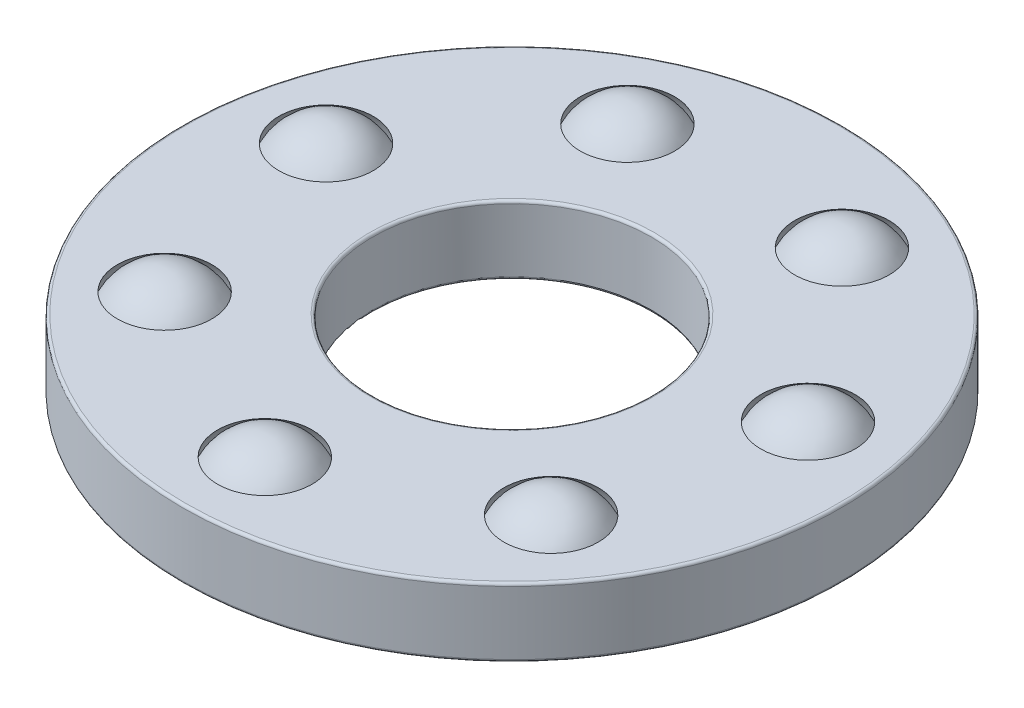
from build123d import *

# Parameters (mm, degrees)
SKETCH1_W         = 3.462
SKETCH1_H         = 1.25
CIRPATTERN1_COUNT = 7
CIRPATTERN1_ANGLE = 308.571428571
CIRPATTERN2_COUNT = 7
SKETCH4_W         = 3.462
SKETCH4_H         = 1.46
FILLET1_R         = 0.0492
FILLET2_R         = 0.0492
FILLET3_R         = 0.0492


with BuildPart() as part:
    # Sketch1 → Revolve1 (revolve)
    with BuildSketch(Plane(origin=(0, 0, 0), x_dir=(0, 0, -1), z_dir=(1, 0, 0))):
        with Locations((-4.269, 0)):
            Rectangle(SKETCH1_W, SKETCH1_H)
    revolve(axis=Axis((0, -2.46, 0), (0, 1, 0)))

    # Sketch3 → Cut-Revolve1 (revolve, cut)
    with BuildSketch(Plane(origin=(0, 0, 0), x_dir=(0, 0, -1), z_dir=(1, 0, 0))):
        with BuildLine():
            Line((-4.5, 1.0625), (-4.5, -1.0625))
            ThreePointArc((-4.5, -1.0625), (-5.5625, 0), (-4.5, 1.0625))
        make_face()
    cut_revolve1 = revolve(axis=Axis((0, 1.0625, 4.5), (0, -1, 0)), mode=Mode.SUBTRACT)

    # CirPattern2: Cut-Revolve1 ×7 about axis
    cirpattern2_axis = Axis((0, 2.46, 0), (0, -1, 0))
    for i in range(1, CIRPATTERN2_COUNT):
        add(cut_revolve1.rotate(cirpattern2_axis, i * 360 / CIRPATTERN2_COUNT), mode=Mode.SUBTRACT)

    # Fillet2
    fillet2_edges = [part.edges().sort_by_distance(p)[0] for p in [
        (0, -0.625, -2.538),
        (0, 0.625, -2.538),
        (0, -0.625, -6),
        (0, 0.625, -6),
    ]]
    fillet(fillet2_edges, radius=FILLET2_R)


with BuildPart() as body_2:
    # Sketch2 → Revolve2 (revolve)
    with BuildSketch(Plane(origin=(0, 0, 0), x_dir=(0, 0, -1), z_dir=(1, 0, 0))):
        with BuildLine():
            Line((-4.5, 1), (-4.5, -1))
            ThreePointArc((-4.5, -1), (-5.5, 0), (-4.5, 1))
        make_face()
    revolve(axis=Axis((0, 1, 4.5), (0, -1, 0)))


with BuildPart() as cirpattern1_1:
    # CirPattern1: pattern copy
    add(body_2.part.rotate(Axis((0, 2.46, 0), (0, -1, 0)), 1 * CIRPATTERN1_ANGLE / (CIRPATTERN1_COUNT - 1)))


with BuildPart() as cirpattern1_2:
    # CirPattern1: pattern copy
    add(body_2.part.rotate(Axis((0, 2.46, 0), (0, -1, 0)), 2 * CIRPATTERN1_ANGLE / (CIRPATTERN1_COUNT - 1)))


with BuildPart() as cirpattern1_3:
    # CirPattern1: pattern copy
    add(body_2.part.rotate(Axis((0, 2.46, 0), (0, -1, 0)), 3 * CIRPATTERN1_ANGLE / (CIRPATTERN1_COUNT - 1)))


with BuildPart() as cirpattern1_4:
    # CirPattern1: pattern copy
    add(body_2.part.rotate(Axis((0, 2.46, 0), (0, -1, 0)), 4 * CIRPATTERN1_ANGLE / (CIRPATTERN1_COUNT - 1)))


with BuildPart() as cirpattern1_5:
    # CirPattern1: pattern copy
    add(body_2.part.rotate(Axis((0, 2.46, 0), (0, -1, 0)), 5 * CIRPATTERN1_ANGLE / (CIRPATTERN1_COUNT - 1)))


with BuildPart() as cirpattern1_6:
    # CirPattern1: pattern copy
    add(body_2.part.rotate(Axis((0, 2.46, 0), (0, -1, 0)), 6 * CIRPATTERN1_ANGLE / (CIRPATTERN1_COUNT - 1)))


with BuildPart() as body_9:
    # Sketch4 → Revolve3 (revolve)
    with BuildSketch(Plane(origin=(0, 0, 0), x_dir=(0, 0, -1), z_dir=(1, 0, 0))):
        with Locations((-4.269, 1.73)):
            Rectangle(SKETCH4_W, SKETCH4_H)
        with Locations((-4.269, -1.73)):
            Rectangle(SKETCH4_W, SKETCH4_H)
    revolve(axis=Axis((0, -2.46, 0), (0, 1, 0)))

    # Fillet1
    fillet1_edges = [body_9.edges().sort_by_distance(p)[0] for p in [
        (0, 1, -2.538),
        (0, 2.46, -2.538),
        (0, 1, -6),
        (0, 2.46, -6),
    ]]
    fillet(fillet1_edges, radius=FILLET1_R)

    # Fillet3
    fillet3_edges = [body_9.edges().sort_by_distance(p)[0] for p in [
        (0, -2.46, -2.538),
        (0, -1, -2.538),
        (0, -2.46, -6),
        (0, -1, -6),
    ]]
    fillet(fillet3_edges, radius=FILLET3_R)


solid = Compound([part.part, body_2.part, cirpattern1_1.part, cirpattern1_2.part, cirpattern1_3.part, cirpattern1_4.part, cirpattern1_5.part, cirpattern1_6.part])
